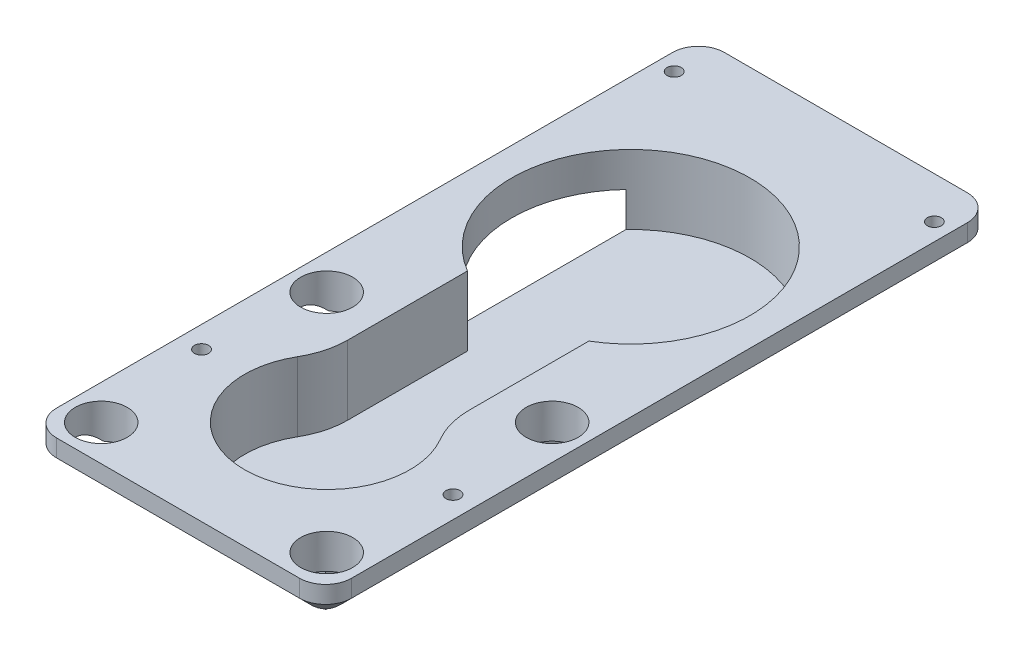
from build123d import *
from OCP.BRepFilletAPI import BRepFilletAPI_MakeChamfer

# Parameters (mm, degrees)
EXTRUDE_1_DEPTH     = 12
SKETCH_2_R          = 3
SKETCH_2_R_2        = 0.81
CUT_EXTRUDE_1_DEPTH = 12
CUT_EXTRUDE_2_DEPTH = 8
FILLET_1_R          = 3
SKETCH_4_R          = 2.25
CUT_EXTRUDE_3_DEPTH = 10
SKETCH_5_W          = 20
SKETCH_5_H          = 63
CUT_EXTRUDE_4_DEPTH = 8
CHAMFER_4_SIZE      = 3.356398525
CHAMFER_4_SIZE_2    = 4
CHAMFER_5_SIZE      = 2


# Some blends are built 0.0001 mm under size
with BuildPart() as part:
    # 草图1 → 凸台-拉伸1 (new body)
    with BuildSketch(Plane(origin=(0, 0, 0), x_dir=(1, 0, 0), z_dir=(0, 1, 0))):
        with BuildLine():
            Line((0, 0), (28, 0))
            ThreePointArc((28, 0), (30.121320344, 0.878679656), (31, 3))
            Line((31, 3), (31, 77))
            Line((31, 77), (-3, 77))
            Line((-3, 77), (-3, 3))
            ThreePointArc((-3, 3), (-2.121320344, 0.878679656), (0, 0))
        make_face()
    extrude(amount=EXTRUDE_1_DEPTH)

    # 草图2 → 切除-拉伸1 (cut)
    with BuildSketch(Plane(origin=(14.000000253, 12, -382.2), x_dir=(1, 0, 0), z_dir=(0, 1, 0))):
        with Locations(Location((13, -352.069110398, 0), (0, 0, 270))):
            Circle(SKETCH_2_R)
        with Locations(Location((-13, -352.069110398, 0), (0, 0, 270))):
            Circle(SKETCH_2_R)
        with Locations(Location((13, -378.069110398, 0), (0, 0, 270))):
            Circle(SKETCH_2_R)
        with Locations(Location((-13, -378.069110398, 0), (0, 0, 270))):
            Circle(SKETCH_2_R)
        with Locations(Location((-15.000000143, -309.999984702, 0), (0, 0, 270))):
            Circle(SKETCH_2_R_2)
        with Locations(Location((15.000000143, -309.999984702, 0), (0, 0, 270))):
            Circle(SKETCH_2_R_2)
        with Locations(Location((14.500000253, -365.000006616, 0), (0, 0, 270))):
            Circle(SKETCH_2_R_2)
        with Locations(Location((-14.500000253, -365.000006616, 0), (0, 0, 270))):
            Circle(SKETCH_2_R_2)
    extrude(amount=-CUT_EXTRUDE_1_DEPTH, mode=Mode.SUBTRACT)

    # 草图3 → 切除-拉伸2 (cut)
    with BuildSketch(Plane(origin=(14.000000253, 12, -382.2), x_dir=(1, 0, 0), z_dir=(0, 1, 0))):
        with BuildLine():
            Line((-7.000000134, -341.834781862), (-7.000000134, -355.639881164))
            ThreePointArc((-7.000000134, -355.639881164), (-7.313370109, -357.994123887), (-8.231657645, -360.184422392))
            ThreePointArc((-8.231657645, -360.184422392), (0, -374.536779603), (8.231657645, -360.184422392))
            ThreePointArc((8.231657645, -360.184422392), (7.313370109, -357.994123887), (7.000000134, -355.639881164))
            Line((7.000000134, -355.639881164), (7.000000134, -341.834782031))
            ThreePointArc((7.000000134, -341.834782031), (3.09e-07, -316.249981647), (-7.000000134, -341.834781862))
        make_face()
    extrude(amount=-CUT_EXTRUDE_2_DEPTH, mode=Mode.SUBTRACT)

    # 圆角1
    fillet_1_edges = [part.edges().sort_by_distance(p)[0] for p in [
        (-3, 6, -77),
        (31, 6, -77),
    ]]
    fillet(fillet_1_edges, radius=FILLET_1_R)

    # 草图4 → 切除-拉伸3 (cut)
    with BuildSketch(Plane.XZ):
        with Locations(Location((-0.5, -17.199993384, 0), (0, 0, 270))):
            Circle(SKETCH_4_R)
        with Locations(Location((28.500000507, -17.199993384, 0), (0, 0, 270))):
            Circle(SKETCH_4_R)
        with Locations((-0.99999989, -72.200015298)):
            Circle(SKETCH_4_R)
        with Locations((29.000000396, -72.200015298)):
            Circle(SKETCH_4_R)
    extrude(amount=-CUT_EXTRUDE_3_DEPTH, mode=Mode.SUBTRACT)

    # 草图5 → 切除-拉伸4 (cut)
    with BuildSketch(Plane.XZ):
        Polygon((28, -77), (0, -77), (-3, -77), (-3, -71.169239105), (-3, -3), (-3, 0), (0, 0), (28, 0), (31, 0), (31, -3), (31, -71.169238122), (31, -77), align=None)
        with Locations((14, -38.5)):
            Rectangle(SKETCH_5_W, SKETCH_5_H, mode=Mode.SUBTRACT)
    extrude(amount=-CUT_EXTRUDE_4_DEPTH, mode=Mode.SUBTRACT)

    # 倒角4
    chamfer_4_edges_1 = [part.edges().sort_by_distance(p)[0] for p in [
        (24, 0, -38.5),
    ]]
    chamfer_4_side_1 = [part.faces().sort_by_distance(p)[0] for p in [
        (23.93287203, 0, -38.5),
    ]]
    chamfer_4_edges_2 = [part.edges().sort_by_distance(p)[0] for p in [
        (4, 0, -38.5),
    ]]
    chamfer_4_side_2 = [part.faces().sort_by_distance(p)[0] for p in [
        (4.06712797, 0, -38.5),
    ]]
    chamfer_4_edges_3 = [part.edges().sort_by_distance(p)[0] for p in [
        (14, 0, -7),
    ]]
    chamfer_4_side_3 = [part.faces().sort_by_distance(p)[0] for p in [
        (14, 0, -7.06712797),
    ]]
    chamfer_4_edges_4 = [part.edges().sort_by_distance(p)[0] for p in [
        (14, 0, -70),
    ]]
    chamfer_4_side_4 = [part.faces().sort_by_distance(p)[0] for p in [
        (14, 0, -69.93287203),
    ]]
    chamfer_4 = BRepFilletAPI_MakeChamfer(part.part.solid().wrapped)
    for e in chamfer_4_edges_1:
        chamfer_4.Add(CHAMFER_4_SIZE - 0.0001, CHAMFER_4_SIZE_2 - 0.0001, e.wrapped, chamfer_4_side_1[0].wrapped)
    for e in chamfer_4_edges_2:
        chamfer_4.Add(CHAMFER_4_SIZE - 0.0001, CHAMFER_4_SIZE_2 - 0.0001, e.wrapped, chamfer_4_side_2[0].wrapped)
    for e in chamfer_4_edges_3:
        chamfer_4.Add(CHAMFER_4_SIZE - 0.0001, CHAMFER_4_SIZE_2 - 0.0001, e.wrapped, chamfer_4_side_3[0].wrapped)
    for e in chamfer_4_edges_4:
        chamfer_4.Add(CHAMFER_4_SIZE - 0.0001, CHAMFER_4_SIZE_2 - 0.0001, e.wrapped, chamfer_4_side_4[0].wrapped)
    add(Compound.cast(chamfer_4.Shape()), mode=Mode.REPLACE)  # a hair under: the kernel refuses the full size

    # 倒角5
    # the kernel refuses this chamfer: 2 mm, written as the material it takes off along each edge
    with BuildSketch(Plane(origin=(28, 8, 0), x_dir=(0, -0.027495876610586494, -0.9996219169112968), z_dir=(-1, 0, 0)), Plane(origin=(0, 8, -77), x_dir=(0, -0.027495876610586414, 0.9996219169112968), z_dir=(1, 0, 0))) as chamfer_5_piece_1:
        Polygon((CHAMFER_5_SIZE * 0.999621916911, -CHAMFER_5_SIZE * 0.0274958766106), (-CHAMFER_5_SIZE * 0.0274958766106, -CHAMFER_5_SIZE * 0.999621916911), (0, 0), align=None)
    extrude(amount=28, mode=Mode.SUBTRACT)
    with BuildSketch(Plane(origin=(31, 8, -76.312604098), x_dir=(-0.9996219169112968, -0.02749587661058651, 0), z_dir=(0, 0, 1))) as chamfer_5_piece_2:
        Polygon((CHAMFER_5_SIZE * 0.999621916911, -CHAMFER_5_SIZE * 0.0274958766106), (-CHAMFER_5_SIZE * 0.0274958766106, -CHAMFER_5_SIZE * 0.999621916911), (0, 0), align=None)
    extrude(amount=73.312604098, mode=Mode.SUBTRACT)
    with BuildSketch(Plane(origin=(-3, 8, -68.087425514), x_dir=(0.9996219169112968, -0.027495876610586487, 0), z_dir=(0, 0, -1))) as chamfer_5_piece_3:
        Polygon((CHAMFER_5_SIZE * 0.999621916911, -CHAMFER_5_SIZE * 0.0274958766106), (-CHAMFER_5_SIZE * 0.0274958766106, -CHAMFER_5_SIZE * 0.999621916911), (0, 0), align=None)
    extrude(amount=5.912574486, mode=Mode.SUBTRACT)
    with BuildSketch(Plane(origin=(31, 8, -74), x_dir=(-0.9996219169112968, -0.02749587661058651, 0), z_dir=(0, 0, 1))) as chamfer_5_piece_4:
        Polygon((CHAMFER_5_SIZE * 0.999621916911, -CHAMFER_5_SIZE * 0.0274958766106), (-CHAMFER_5_SIZE * 0.0274958766106, -CHAMFER_5_SIZE * 0.999621916911), (0, 0), align=None)
    extrude(amount=5.912573503, mode=Mode.SUBTRACT)
    with BuildSketch(Plane(origin=(0, 8, -74), x_dir=(0, 0, -1), z_dir=(1, 0, 0))) as chamfer_5_piece_5:
        Polygon((3 - CHAMFER_5_SIZE, 0), (3, CHAMFER_5_SIZE), (3, 0), align=None)
    revolve(axis=Axis((0, 8, -74), (0, 1, 0)), revolution_arc=90, mode=Mode.SUBTRACT)
    with BuildSketch(Plane(origin=(28, 8, -74), x_dir=(1, 0, 0), z_dir=(0, 0, 1))) as chamfer_5_piece_6:
        Polygon((3 - CHAMFER_5_SIZE, 0), (3, CHAMFER_5_SIZE), (3, 0), align=None)
    revolve(axis=Axis((28, 8, -74), (0, 1, 0)), revolution_arc=90, mode=Mode.SUBTRACT)
    with BuildSketch(Plane(origin=(28, 8, -3), x_dir=(1, 0, 0), z_dir=(0, 0, -1))) as chamfer_5_piece_7:
        Polygon((3 - CHAMFER_5_SIZE, 0), (3, -CHAMFER_5_SIZE), (3, 0), align=None)
    revolve(axis=Axis((28, 8, -3), (0, -1, 0)), revolution_arc=90, mode=Mode.SUBTRACT)
    with BuildSketch(Plane(origin=(0, 8, -3), x_dir=(0, 0, 1), z_dir=(1, 0, 0))) as chamfer_5_piece_8:
        Polygon((3 - CHAMFER_5_SIZE, 0), (3, -CHAMFER_5_SIZE), (3, 0), align=None)
    revolve(axis=Axis((0, 8, -3), (0, -1, 0)), revolution_arc=90, mode=Mode.SUBTRACT)
    with BuildSketch(Plane(origin=(-3, 8, -3), x_dir=(0.9996219169112968, -0.027495876610586497, 0), z_dir=(0, 0, -1))) as chamfer_5_piece_9:
        Polygon((CHAMFER_5_SIZE * 0.999621916911, -CHAMFER_5_SIZE * 0.0274958766106), (-CHAMFER_5_SIZE * 0.0274958766106, -CHAMFER_5_SIZE * 0.999621916911), (0, 0), align=None)
    extrude(amount=73.312605081, mode=Mode.SUBTRACT)


solid = part.part
